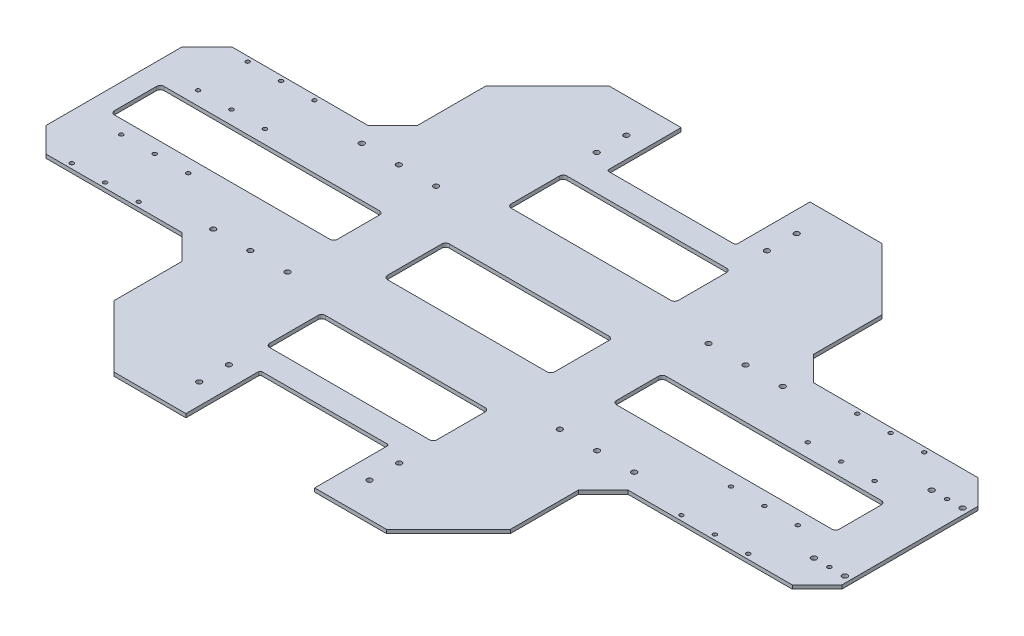
from build123d import *

# Parameters (mm, degrees)
EXTRUDE_1_DEPTH     = 3
CHAMFER_1_SIZE      = 20
CHAMFER_2_SIZE      = 50
SKETCH_2_W          = 104
SKETCH_2_H          = 93.088788678
CUT_EXTRUDE_1_DEPTH = 40
FILLET_1_R          = 1.5
SKETCH_3_R          = 2.1
CUT_EXTRUDE_2_DEPTH = 80
SKETCH_4_R          = 1.6
SKETCH_4_R_2        = 2.1
CUT_EXTRUDE_3_DEPTH = 29
EXTRUDE_2_DEPTH     = 3
SKETCH_6_R          = 2.15
CUT_EXTRUDE_4_DEPTH = 3
CUT_EXTRUDE_5_DEPTH = 15
SKETCH_8_R          = 1.6
CUT_EXTRUDE_6_DEPTH = 15


with BuildPart() as part:
    # 草图1 → 凸台-拉伸1 (new body)
    with BuildSketch(Plane(origin=(0, 0, 0), x_dir=(1, 0, 0), z_dir=(0, 1, 0))):
        Polygon((-310, -75), (-160, -75), (-160, -200), (160, -200), (160, -75), (310, -75), (310, 75), (160, 75), (160, 200), (-160, 200), (-160, 75), (-310, 75), align=None)
    extrude(amount=EXTRUDE_1_DEPTH)

    # 倒角1
    chamfer_1_edges = [part.edges().sort_by_distance(p)[0] for p in [
        (-160, 1.5, -75),
        (-310, 1.5, -75),
        (-310, 1.5, 75),
        (-160, 1.5, 75),
        (160, 1.5, 75),
        (160, 1.5, -75),
        (310, 1.5, 75),
        (310, 1.5, -75),
    ]]
    chamfer(chamfer_1_edges, length=CHAMFER_1_SIZE)

    # 倒角2
    chamfer_2_edges = [part.edges().sort_by_distance(p)[0] for p in [
        (160, 1.5, 200),
        (-160, 1.5, 200),
        (160, 1.5, -200),
        (-160, 1.5, -200),
    ]]
    chamfer(chamfer_2_edges, length=CHAMFER_2_SIZE)

    # 草图2 → 切除-拉伸1 (cut)
    with BuildSketch(Plane(origin=(0, 0, 0), x_dir=(-1, 0, 0), z_dir=(0, -1, 0))):
        with Locations((0, -186.544394339)):
            Rectangle(SKETCH_2_W, SKETCH_2_H)
        with Locations((0, 186.544394339)):
            Rectangle(SKETCH_2_W, SKETCH_2_H)
    extrude(amount=-CUT_EXTRUDE_1_DEPTH, mode=Mode.SUBTRACT)

    # 圆角1
    fillet_1_edges = [part.edges().sort_by_distance(p)[0] for p in [
        (-52, 1.5, -140),
        (52, 1.5, -140),
        (52, 1.5, 140),
        (-52, 1.5, 140),
    ]]
    fillet(fillet_1_edges, radius=FILLET_1_R)

    # 草图3 → 切除-拉伸2 (cut)
    with BuildSketch(Plane.XZ):
        with Locations((-68.75, 172.5)):
            Circle(SKETCH_3_R)
        with Locations((-68.75, 148.5)):
            Circle(SKETCH_3_R)
        with Locations((68.75, 172.5)):
            Circle(SKETCH_3_R)
        with Locations((68.75, 148.5)):
            Circle(SKETCH_3_R)
        with Locations((-68.75, -148.5)):
            Circle(SKETCH_3_R)
        with Locations((-68.75, -172.5)):
            Circle(SKETCH_3_R)
        with Locations((68.75, -148.5)):
            Circle(SKETCH_3_R)
        with Locations((68.75, -172.5)):
            Circle(SKETCH_3_R)
    extrude(amount=-CUT_EXTRUDE_2_DEPTH, mode=Mode.SUBTRACT)

    # 草图4 → 切除-拉伸3 (cut)
    with BuildSketch(Plane.XZ):
        with Locations((273.200177837, 71)):
            Circle(SKETCH_4_R)
        with Locations((273.200177837, 30.998400192)):
            Circle(SKETCH_4_R)
        with Locations((246.200177837, 71)):
            Circle(SKETCH_4_R)
        with Locations((219.200177837, 71)):
            Circle(SKETCH_4_R)
        with Locations((246.200177837, 30.998400192)):
            Circle(SKETCH_4_R)
        with Locations((219.200177837, 30.998400192)):
            Circle(SKETCH_4_R)
        with Locations((110, 60)):
            Circle(SKETCH_4_R_2)
        with Locations((140, 60)):
            Circle(SKETCH_4_R_2)
        with Locations((170, 60)):
            Circle(SKETCH_4_R_2)
        with Locations((170, -60)):
            Circle(SKETCH_4_R_2)
        with Locations((140, -60)):
            Circle(SKETCH_4_R_2)
        with Locations((110, -60)):
            Circle(SKETCH_4_R_2)
        with Locations((219.200177837, -30.998400192)):
            Circle(SKETCH_4_R)
        with Locations((246.200177837, -30.998400192)):
            Circle(SKETCH_4_R)
        with Locations((219.200177837, -71)):
            Circle(SKETCH_4_R)
        with Locations((246.200177837, -71)):
            Circle(SKETCH_4_R)
        with Locations((273.200177837, -30.998400192)):
            Circle(SKETCH_4_R)
        with Locations((273.200177837, -71)):
            Circle(SKETCH_4_R)
        with Locations((-273.200177837, -71)):
            Circle(SKETCH_4_R)
        with Locations((-273.200177837, -30.998400192)):
            Circle(SKETCH_4_R)
        with Locations((-246.200177837, -71)):
            Circle(SKETCH_4_R)
        with Locations((-219.200177837, -71)):
            Circle(SKETCH_4_R)
        with Locations((-246.200177837, -30.998400192)):
            Circle(SKETCH_4_R)
        with Locations((-219.200177837, -30.998400192)):
            Circle(SKETCH_4_R)
        with Locations((-110, -60)):
            Circle(SKETCH_4_R_2)
        with Locations((-140, -60)):
            Circle(SKETCH_4_R_2)
        with Locations((-170, -60)):
            Circle(SKETCH_4_R_2)
        with Locations((-170, 60)):
            Circle(SKETCH_4_R_2)
        with Locations((-140, 60)):
            Circle(SKETCH_4_R_2)
        with Locations((-110, 60)):
            Circle(SKETCH_4_R_2)
        with Locations((-219.200177837, 30.998400192)):
            Circle(SKETCH_4_R)
        with Locations((-246.200177837, 30.998400192)):
            Circle(SKETCH_4_R)
        with Locations((-219.200177837, 71)):
            Circle(SKETCH_4_R)
        with Locations((-246.200177837, 71)):
            Circle(SKETCH_4_R)
        with Locations((-273.200177837, 30.998400192)):
            Circle(SKETCH_4_R)
        with Locations((-273.200177837, 71)):
            Circle(SKETCH_4_R)
    extrude(amount=-CUT_EXTRUDE_3_DEPTH, mode=Mode.SUBTRACT)

    # 草图5 → 凸台-拉伸2 (add)
    with BuildSketch(Plane.XZ):
        Polygon((310, 55), (290, 75), (312.700177837, 75), (332.700177837, 55), (332.700177837, -55), (312.700177837, -75), (290, -75), (310, -55), align=None)
    extrude(amount=-EXTRUDE_2_DEPTH)

    # 草图6 → 切除-拉伸4 (cut)
    with BuildSketch(Plane.XZ):
        with Locations((302.700177837, 47.5)):
            Circle(SKETCH_6_R)
        with Locations((327.700177837, 47.5)):
            Circle(SKETCH_6_R)
        with Locations((327.700177837, -47.5)):
            Circle(SKETCH_6_R)
        with Locations((302.700177837, -47.5)):
            Circle(SKETCH_6_R)
    extrude(amount=-CUT_EXTRUDE_4_DEPTH, mode=Mode.SUBTRACT)

    # 草图7 → 切除-拉伸5 (cut)
    with BuildSketch(Plane.XZ):
        with BuildLine():
            Line((289.700177837, -20), (115.700177837, -20))
            ThreePointArc((115.700177837, -20), (113.578857493, -19.121320344), (112.700177837, -17))
            Line((112.700177837, -17), (112.700177837, 17))
            ThreePointArc((112.700177837, 17), (113.578857493, 19.121320344), (115.700177837, 20))
            Line((115.700177837, 20), (289.700177837, 20))
            ThreePointArc((289.700177837, 20), (291.82149818, 19.121320344), (292.700177837, 17))
            Line((292.700177837, 17), (292.700177837, -17))
            ThreePointArc((292.700177837, -17), (291.82149818, -19.121320344), (289.700177837, -20))
        make_face()
        with BuildLine():
            Line((64.700177837, -25), (-64.325085215, -25))
            ThreePointArc((-64.325085215, -25), (-66.446405558, -24.121320344), (-67.325085215, -22))
            Line((-67.325085215, -22), (-67.325085215, 22))
            ThreePointArc((-67.325085215, 22), (-66.446405558, 24.121320343), (-64.325085215, 25))
            Line((-64.325085215, 25), (64.700177837, 25))
            ThreePointArc((64.700177837, 25), (66.82149818, 24.121320343), (67.700177837, 22))
            Line((67.700177837, 22), (67.700177837, -22))
            ThreePointArc((67.700177837, -22), (66.82149818, -24.121320344), (64.700177837, -25))
        make_face()
        with BuildLine():
            Line((64.700177837, -120), (-64.325085215, -120))
            ThreePointArc((-64.325085215, -120), (-66.446405558, -119.121320344), (-67.325085215, -117))
            Line((-67.325085215, -117), (-67.325085215, -78))
            ThreePointArc((-67.325085215, -78), (-66.446405558, -75.878679656), (-64.325085215, -75))
            Line((-64.325085215, -75), (64.700177837, -75))
            ThreePointArc((64.700177837, -75), (66.82149818, -75.878679656), (67.700177837, -78))
            Line((67.700177837, -78), (67.700177837, -117))
            ThreePointArc((67.700177837, -117), (66.82149818, -119.121320344), (64.700177837, -120))
        make_face()
        with BuildLine():
            Line((-112.700177837, -17), (-112.700177837, 17))
            ThreePointArc((-112.700177837, 17), (-113.578857493, 19.121320344), (-115.700177837, 20))
            Line((-115.700177837, 20), (-289.700177837, 20))
            ThreePointArc((-289.700177837, 20), (-291.82149818, 19.121320344), (-292.700177837, 17))
            Line((-292.700177837, 17), (-292.700177837, -17))
            ThreePointArc((-292.700177837, -17), (-291.82149818, -19.121320344), (-289.700177837, -20))
            Line((-289.700177837, -20), (-115.700177837, -20))
            ThreePointArc((-115.700177837, -20), (-113.578857493, -19.121320344), (-112.700177837, -17))
        make_face()
        with BuildLine():
            Line((-67.325085215, 117), (-67.325085215, 78))
            ThreePointArc((-67.325085215, 78), (-66.446405558, 75.878679656), (-64.325085215, 75))
            Line((-64.325085215, 75), (64.700177837, 75))
            ThreePointArc((64.700177837, 75), (66.82149818, 75.878679656), (67.700177837, 78))
            Line((67.700177837, 78), (67.700177837, 117))
            ThreePointArc((67.700177837, 117), (66.82149818, 119.121320344), (64.700177837, 120))
            Line((64.700177837, 120), (-64.325085215, 120))
            ThreePointArc((-64.325085215, 120), (-66.446405558, 119.121320344), (-67.325085215, 117))
        make_face()
    extrude(amount=-CUT_EXTRUDE_5_DEPTH, mode=Mode.SUBTRACT)

    # 草图8 → 切除-拉伸6 (cut)
    with BuildSketch(Plane.XZ):
        with Locations((315.200177837, 47.5)):
            Circle(SKETCH_8_R)
        with Locations((315.200177837, -47.5)):
            Circle(SKETCH_8_R)
    extrude(amount=-CUT_EXTRUDE_6_DEPTH, mode=Mode.SUBTRACT)


solid = part.part
